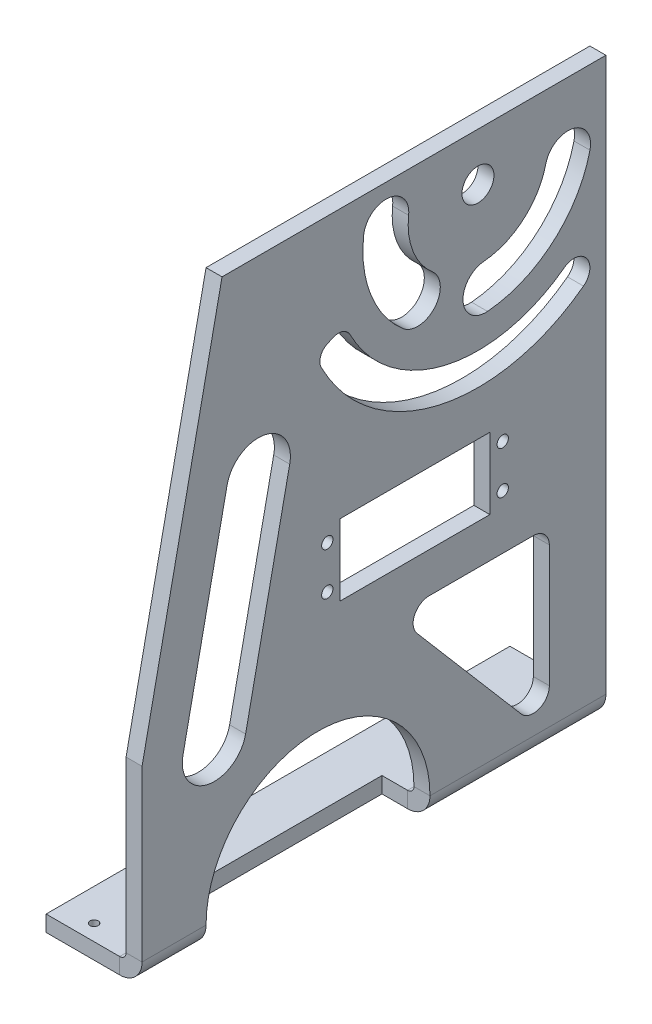
from build123d import *

# Parameters (mm, degrees)
BOSS_EXTRUDE1_DEPTH  = 6.35
SKETCH5_W            = 184.15
SKETCH5_H            = 6.35
BOSS_EXTRUDE4_DEPTH  = 31.75
SKETCH6_W            = 12.7
SKETCH6_H            = 88.9
CUT_EXTRUDE2_DEPTH   = 270.576010849
CUT_EXTRUDE3_REACH   = 277.64
SKETCH7_R            = 2.25
SKETCH7_W            = 59.436
SKETCH7_H            = 28.313784743
SKETCH8_R            = 6.35
CUT_EXTRUDE4_DEPTH   = 276.640473489
FILLET1_R            = 2.54
CONVERT_SOLID1_START = -34.925
CONVERT_SOLID1_DEPTH = 184.15
CUT_EXTRUDE5_REACH   = 277.64
CUT_EXTRUDE6_REACH   = 271.576
SKETCH10_R           = 1.63195


# Read off the part's stored shape, not the designer's step: Convert-Solid1
with BuildPart() as part:
    # Sketch1 → Boss-Extrude1 (new body)
    with BuildSketch(Plane(origin=(0, 0, 0), x_dir=(0, 0, -1), z_dir=(1, 0, 0))):
        with BuildLine():
            Line((-117.475, 228.6), (34.925, 228.6))
            Line((34.925, 228.6), (34.925, 8.89))
            Line((34.925, 8.89), (34.925, 0))
            Line((34.925, 0), (-34.925, 0))
            Line((-34.925, 0), (-34.925, 8.89))
            ThreePointArc((-34.925, 8.89), (-79.375, 53.34), (-123.825, 8.89))
            Line((-123.825, 8.89), (-123.825, 0))
            Line((-123.825, 0), (-149.225, 0))
            Line((-149.225, 0), (-149.225, 76.2))
            Line((-149.225, 76.2), (-117.475, 228.6))
        make_face()
    extrude(amount=BOSS_EXTRUDE1_DEPTH)

    # Sketch5 → Boss-Extrude4 (add)
    with BuildSketch(Plane.ZY):
        with Locations((57.15, 3.175)):
            Rectangle(SKETCH5_W, SKETCH5_H)
    extrude(amount=BOSS_EXTRUDE4_DEPTH)

    # Sketch6 → Cut-Extrude2 (cut, through all)
    with BuildSketch(Plane(origin=(0, 6.35, 0), x_dir=(1, 0, 0), z_dir=(0, 1, 0))):
        with Locations((-6.35, -79.375)):
            Rectangle(SKETCH6_W, SKETCH6_H)
    extrude(amount=-CUT_EXTRUDE2_DEPTH, mode=Mode.SUBTRACT)

    # Sketch7 → Cut-Extrude3 (cut, up to next)
    with BuildSketch(Plane(origin=(6.35, 0, 0), x_dir=(0, 0, -1), z_dir=(1, 0, 0)), mode=Mode.PRIVATE) as cut_extrude3_sk1:
        with Locations((-75.679460058, 116.337237118)):
            Circle(SKETCH7_R)
    cut_extrude3_tool1 = extrude(cut_extrude3_sk1.sketch, amount=-CUT_EXTRUDE3_REACH, mode=Mode.PRIVATE) & part.part
    # Sketch7 → Cut-Extrude3 (cut, up to next)
    with BuildSketch(Plane(origin=(6.35, 0, 0), x_dir=(0, 0, -1), z_dir=(1, 0, 0)), mode=Mode.PRIVATE) as cut_extrude3_sk2:
        with Locations((-75.679460058, 99.360389657)):
            Circle(SKETCH7_R)
    cut_extrude3_tool2 = extrude(cut_extrude3_sk2.sketch, amount=-CUT_EXTRUDE3_REACH, mode=Mode.PRIVATE) & part.part
    # Sketch7 → Cut-Extrude3 (cut, up to next)
    with BuildSketch(Plane(origin=(6.35, 0, 0), x_dir=(0, 0, -1), z_dir=(1, 0, 0)), mode=Mode.PRIVATE) as cut_extrude3_sk3:
        with Locations((-6.03755368, 99.360389657)):
            Circle(SKETCH7_R)
    cut_extrude3_tool3 = extrude(cut_extrude3_sk3.sketch, amount=-CUT_EXTRUDE3_REACH, mode=Mode.PRIVATE) & part.part
    # Sketch7 → Cut-Extrude3 (cut, up to next)
    with BuildSketch(Plane(origin=(6.35, 0, 0), x_dir=(0, 0, -1), z_dir=(1, 0, 0)), mode=Mode.PRIVATE) as cut_extrude3_sk4:
        with Locations((-6.03755368, 116.337237118)):
            Circle(SKETCH7_R)
    cut_extrude3_tool4 = extrude(cut_extrude3_sk4.sketch, amount=-CUT_EXTRUDE3_REACH, mode=Mode.PRIVATE) & part.part
    # Sketch7 → Cut-Extrude3 (cut, up to next)
    with BuildSketch(Plane(origin=(6.35, 0, 0), x_dir=(0, 0, -1), z_dir=(1, 0, 0)), mode=Mode.PRIVATE) as cut_extrude3_sk5:
        with Locations((-40.858506869, 107.848813388)):
            Rectangle(SKETCH7_W, SKETCH7_H)
    cut_extrude3_tool5 = extrude(cut_extrude3_sk5.sketch, amount=-CUT_EXTRUDE3_REACH, mode=Mode.PRIVATE) & part.part
    add(cut_extrude3_tool1.solids().sort_by_distance((6.35, 116.337237, 75.67946))[0], mode=Mode.SUBTRACT)
    add(cut_extrude3_tool2.solids().sort_by_distance((6.35, 99.36039, 75.67946))[0], mode=Mode.SUBTRACT)
    add(cut_extrude3_tool3.solids().sort_by_distance((6.35, 99.36039, 6.037554))[0], mode=Mode.SUBTRACT)
    add(cut_extrude3_tool4.solids().sort_by_distance((6.35, 116.337237, 6.037554))[0], mode=Mode.SUBTRACT)
    add(cut_extrude3_tool5.solids().sort_by_distance((6.35, 107.848813, 40.858507))[0], mode=Mode.SUBTRACT)

    # Sketch8 → Cut-Extrude4 (cut, through all)
    with BuildSketch(Plane(origin=(6.35, 0, 0), x_dir=(0, 0, -1), z_dir=(1, 0, 0))):
        with Locations((-15.875, 209.55)):
            Circle(SKETCH8_R)
    extrude(amount=-CUT_EXTRUDE4_DEPTH, mode=Mode.SUBTRACT)

    # Fillet1
    fillet1_edges = [part.edges().sort_by_distance(p)[0] for p in [
        (0, 6.35, 136.525),
        (0, 6.35, 0),
    ]]
    fillet(fillet1_edges, radius=FILLET1_R)

    # Convert-Solid1 outline → Convert-Solid1 (cut)
    with BuildSketch(Plane.XY.offset(CONVERT_SOLID1_START)):
        with BuildLine():
            ThreePointArc((6.35, 8.89), (3.746179285, 2.603820715), (-2.54, 0))
            Line((-2.54, 0), (6.35, 0))
            Line((6.35, 0), (6.35, 8.89))
        make_face()
    extrude(amount=CONVERT_SOLID1_DEPTH, mode=Mode.SUBTRACT)

    # Sketch9 → Cut-Extrude5 (cut, up to next)
    with BuildSketch(Plane(origin=(6.35, 0, 0), x_dir=(0, 0, -1), z_dir=(1, 0, 0)), mode=Mode.PRIVATE) as cut_extrude5_sk1:
        with BuildLine():
            Line((-75.494212356, 184.752903033), (-73.141435562, 185.731480776))
            ThreePointArc((-73.141435562, 185.731480776), (-69.446832384, 185.812370314), (-66.675, 183.368279277))
            ThreePointArc((-66.675, 183.368279277), (-28.664883279, 153.84953873), (18.415, 163.83))
            ThreePointArc((18.415, 163.83), (27.305, 162.56), (26.035, 153.67))
            ThreePointArc((26.035, 153.67), (-31.616379009, 141.496848075), (-78.066338809, 177.749687467))
            ThreePointArc((-78.066338809, 177.749687467), (-78.311881244, 181.813820193), (-75.494212356, 184.752903033))
        make_face()
    cut_extrude5_tool1 = extrude(cut_extrude5_sk1.sketch, amount=-CUT_EXTRUDE5_REACH, mode=Mode.PRIVATE) & part.part
    # Sketch9 → Cut-Extrude5 (cut, up to next)
    with BuildSketch(Plane(origin=(6.35, 0, 0), x_dir=(0, 0, -1), z_dir=(1, 0, 0)), mode=Mode.PRIVATE) as cut_extrude5_sk2:
        with BuildLine():
            Line((-108.118493719, 66.728864942), (-90.609860799, 150.770302958))
            ThreePointArc((-90.609860799, 150.770302958), (-100.452693102, 165.793573316), (-115.47596346, 155.950741012))
            Line((-115.47596346, 155.950741012), (-132.98459638, 71.909302996))
            ThreePointArc((-132.98459638, 71.909302996), (-123.141764077, 56.886032638), (-108.118493719, 66.728864942))
        make_face()
    cut_extrude5_tool2 = extrude(cut_extrude5_sk2.sketch, amount=-CUT_EXTRUDE5_REACH, mode=Mode.PRIVATE) & part.part
    # Sketch9 → Cut-Extrude5 (cut, up to next)
    with BuildSketch(Plane(origin=(6.35, 0, 0), x_dir=(0, 0, -1), z_dir=(1, 0, 0)), mode=Mode.PRIVATE) as cut_extrude5_sk3:
        with BuildLine():
            Line((-40.087105739, 67.347842772), (1.2905656, 18.917236412))
            ThreePointArc((1.2905656, 18.917236412), (8.316769711, 17.084699632), (12.468452925, 23.041986075))
            Line((12.468452925, 23.041986075), (12.468863596, 71.472592434))
            ThreePointArc((12.468863596, 71.472592434), (10.609010694, 75.962755303), (6.118863596, 77.82264628))
            Line((6.118863596, 77.82264628), (-35.259218414, 77.82264628))
            ThreePointArc((-35.259218414, 77.82264628), (-41.026150106, 74.130652838), (-40.087105739, 67.347842772))
        make_face()
    cut_extrude5_tool3 = extrude(cut_extrude5_sk3.sketch, amount=-CUT_EXTRUDE5_REACH, mode=Mode.PRIVATE) & part.part
    # Sketch9 → Cut-Extrude5 (cut, up to next)
    with BuildSketch(Plane(origin=(6.35, 0, 0), x_dir=(0, 0, -1), z_dir=(1, 0, 0)), mode=Mode.PRIVATE) as cut_extrude5_sk4:
        with BuildLine():
            ThreePointArc((-61.255276679, 214.786351204), (-58.421011662, 192.917929262), (-45.672728213, 174.925091643))
            ThreePointArc((-45.672728213, 174.925091643), (-32.993270754, 175.875161813), (-33.943340924, 188.554619273))
            ThreePointArc((-33.943340924, 188.554619273), (-41.673471553, 199.464871288), (-43.392074603, 212.725147383))
            ThreePointArc((-43.392074603, 212.725147383), (-51.29307373, 222.687350332), (-61.255276679, 214.786351204))
        make_face()
    cut_extrude5_tool4 = extrude(cut_extrude5_sk4.sketch, amount=-CUT_EXTRUDE5_REACH, mode=Mode.PRIVATE) & part.part
    # Sketch9 → Cut-Extrude5 (cut, up to next)
    with BuildSketch(Plane(origin=(6.35, 0, 0), x_dir=(0, 0, -1), z_dir=(1, 0, 0)), mode=Mode.PRIVATE) as cut_extrude5_sk5:
        with BuildLine():
            ThreePointArc((-12.080418407, 164.026489196), (13.963017041, 174.959804504), (28.599113727, 199.117258578))
            ThreePointArc((28.599113727, 199.117258578), (21.899199613, 209.923850348), (11.092607844, 203.223936233))
            ThreePointArc((11.092607844, 203.223936233), (2.217770715, 188.575667985), (-13.574093253, 181.946073037))
            ThreePointArc((-13.574093253, 181.946073037), (-21.787047751, 172.239443693), (-12.080418407, 164.026489196))
        make_face()
    cut_extrude5_tool5 = extrude(cut_extrude5_sk5.sketch, amount=-CUT_EXTRUDE5_REACH, mode=Mode.PRIVATE) & part.part
    add(cut_extrude5_tool1.solids().sort_by_distance((6.35, 181.411079, 77.215324))[0], mode=Mode.SUBTRACT)
    add(cut_extrude5_tool2.solids().sort_by_distance((6.35, 111.339803, 111.797229))[0], mode=Mode.SUBTRACT)
    add(cut_extrude5_tool3.solids().sort_by_distance((6.35, 54.455432, 7.917782))[0], mode=Mode.SUBTRACT)
    add(cut_extrude5_tool4.solids().sort_by_distance((6.35, 197.006846, 47.961274))[0], mode=Mode.SUBTRACT)
    add(cut_extrude5_tool5.solids().sort_by_distance((6.35, 184.385964, -5.831872))[0], mode=Mode.SUBTRACT)

    # Sketch10 → Cut-Extrude6 (cut, up to next)
    with BuildSketch(Plane(origin=(0, 6.35, 0), x_dir=(1, 0, 0), z_dir=(0, 1, 0)), mode=Mode.PRIVATE) as cut_extrude6_sk1:
        with Locations(Location((-19.05, 9.525, 0), (0, 0, 270))):
            Circle(SKETCH10_R)
    cut_extrude6_tool1 = extrude(cut_extrude6_sk1.sketch, amount=-CUT_EXTRUDE6_REACH, mode=Mode.PRIVATE) & part.part
    # Sketch10 → Cut-Extrude6 (cut, up to next)
    with BuildSketch(Plane(origin=(0, 6.35, 0), x_dir=(1, 0, 0), z_dir=(0, 1, 0)), mode=Mode.PRIVATE) as cut_extrude6_sk2:
        with Locations(Location((-19.05, -15.875, 0), (0, 0, 270))):
            Circle(SKETCH10_R)
    cut_extrude6_tool2 = extrude(cut_extrude6_sk2.sketch, amount=-CUT_EXTRUDE6_REACH, mode=Mode.PRIVATE) & part.part
    # Sketch10 → Cut-Extrude6 (cut, up to next)
    with BuildSketch(Plane(origin=(0, 6.35, 0), x_dir=(1, 0, 0), z_dir=(0, 1, 0)), mode=Mode.PRIVATE) as cut_extrude6_sk3:
        with Locations(Location((-19.05, -142.875, 0), (0, 0, 270))):
            Circle(SKETCH10_R)
    cut_extrude6_tool3 = extrude(cut_extrude6_sk3.sketch, amount=-CUT_EXTRUDE6_REACH, mode=Mode.PRIVATE) & part.part
    add(cut_extrude6_tool1.solids().sort_by_distance((-19.05, 6.35, -9.525))[0], mode=Mode.SUBTRACT)
    add(cut_extrude6_tool2.solids().sort_by_distance((-19.05, 6.35, 15.875))[0], mode=Mode.SUBTRACT)
    add(cut_extrude6_tool3.solids().sort_by_distance((-19.05, 6.35, 142.875))[0], mode=Mode.SUBTRACT)


solid = part.part
